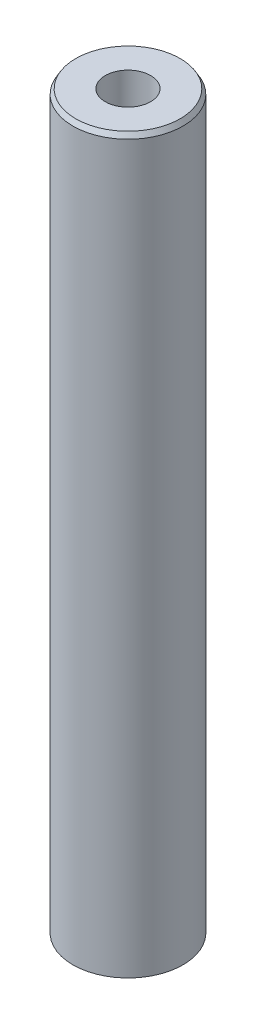
from build123d import *
from OCP.BRepFilletAPI import BRepFilletAPI_MakeChamfer

# Parameters (mm, degrees)
SKETCH1_R           = 45
BOSS_EXTRUDE1_DEPTH = 600
SKETCH2_R           = 18.557324248
CUT_EXTRUDE1_DEPTH  = 604.365560834
CHAMFER1_SIZE       = 4.024097519
CHAMFER1_SIZE2      = 2.323313786


with BuildPart() as part:
    # Sketch1 → Boss-Extrude1 (new body)
    with BuildSketch(Plane(origin=(0, 0, 0), x_dir=(1, 0, 0), z_dir=(0, 1, 0))):
        Circle(SKETCH1_R)
    extrude(amount=BOSS_EXTRUDE1_DEPTH)

    # Sketch2 → Cut-Extrude1 (cut, through all)
    with BuildSketch(Plane(origin=(0, 0, 0), x_dir=(1, 0, 0), z_dir=(0, 1, 0))):
        Circle(SKETCH2_R)
    extrude(amount=CUT_EXTRUDE1_DEPTH, mode=Mode.SUBTRACT)

    # Chamfer1: one chamfer whose edges measure the first distance from different faces: ONE call of the kernel's chamfer builder (chamfer() names one face for all edges)
    chamfer1_edges_1 = [part.edges().sort_by_distance(p)[0] for p in [
        (-45, 600, 0),
    ]]
    chamfer1_side_1 = [part.faces().sort_by_distance(p)[0] for p in [
        (-45, 300, 0),
    ]]
    chamfer1_edges_2 = [part.edges().sort_by_distance(p)[0] for p in [
        (-45, 0, 0),
    ]]
    chamfer1_side_2 = [part.faces().sort_by_distance(p)[0] for p in [
        (-43.727207794, 0, 0),
    ]]
    chamfer1 = BRepFilletAPI_MakeChamfer(part.part.solid().wrapped)
    for e in chamfer1_edges_1:
        chamfer1.Add(CHAMFER1_SIZE, CHAMFER1_SIZE2, e.wrapped, chamfer1_side_1[0].wrapped)  # the first distance lies on this face
    for e in chamfer1_edges_2:
        chamfer1.Add(CHAMFER1_SIZE, CHAMFER1_SIZE2, e.wrapped, chamfer1_side_2[0].wrapped)  # the first distance lies on this face
    add(Compound.cast(chamfer1.Shape()), mode=Mode.REPLACE)


solid = part.part
